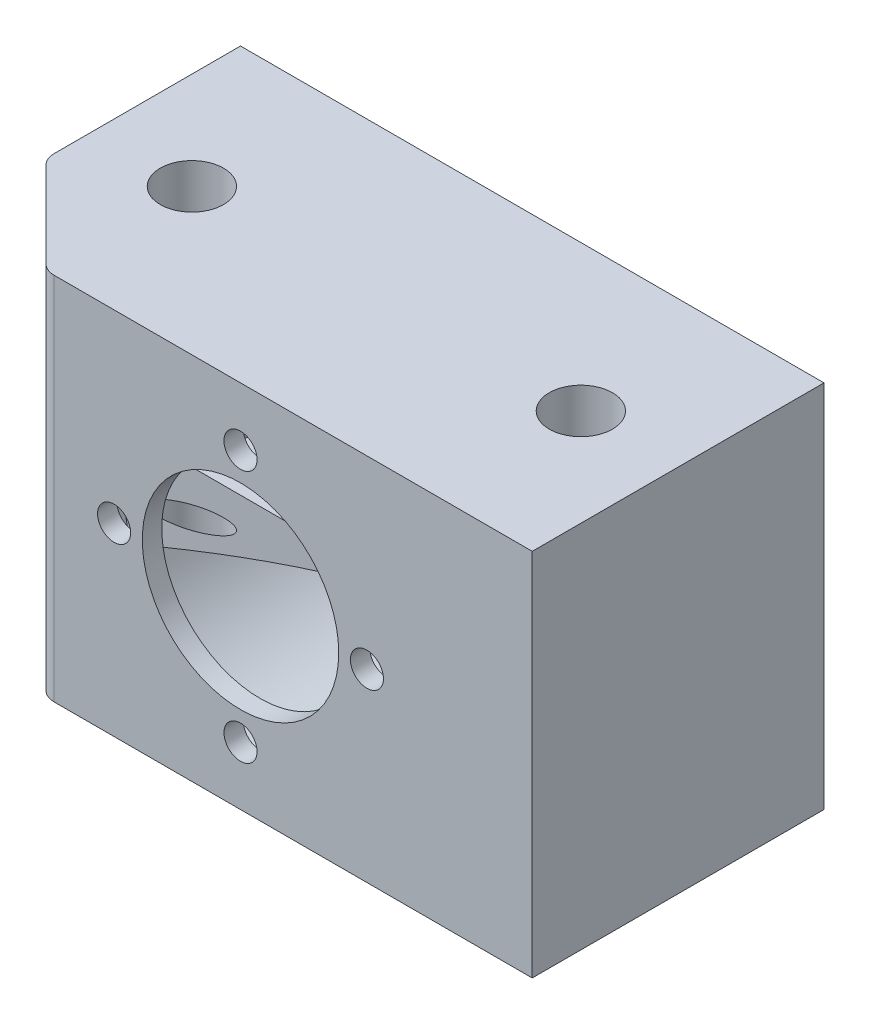
from build123d import *

# Parameters (mm, degrees)
BOSS_EXTRU_1_DEPTH                  = 60
CHANFREIN2_SIZE                     = 10
CHANFREIN2_SIZE2                    = 20
CHANFREIN3_SIZE                     = 20
CHANFREIN3_SIZE2                    = 10
CONG_3_R                            = 2
ENL_V_MAT_EXTRU_4_DEPTH             = 2
ENL_V_MAT_EXTRU_4_DEPTH_BACK        = 66.720872054
ENL_V_MAT_EXTRU_4_START             = -4
ESQUISSE5_R                         = 16.05
ESQUISSE2_R                         = 1.7
ESQUISSE2_R_2                       = 10.1
ENL_V_MAT_EXTRU_1_DEPTH             = 70.720872183
ESQUISSE3_R                         = 1.6
ENL_V_MAT_EXTRU_2_DEPTH             = 78.097341186
ENL_V_MAT_EXTRU_5_REACH             = 71.721
ESQUISSE6_R                         = 3.25
ENL_V_MAT_EXTRU_5_DIRECTION_2_REACH = 71.721
CHANFREIN1_SIZE                     = 10
BOSS_EXTRU_3_REACH                  = 79.097
ESQUISSE8_W                         = 1.2
ESQUISSE8_H                         = 30
CONG_2_R                            = 2


with BuildPart() as part:
    # Esquisse1 → Boss.-Extru.1 (new body)
    with BuildSketch(Plane(origin=(0, 0, 0), x_dir=(0, 0, -1), z_dir=(1, 0, 0))):
        Polygon((0, -19), (0, 19), (30, 19), (30, 15), (4, 15), (4, -15), (30, -15), (30, -19), align=None)
    extrude(amount=BOSS_EXTRU_1_DEPTH)

    # Chanfrein2
    chanfrein2_edges = [part.edges().sort_by_distance(p)[0] for p in [
        (30, 15, -4),
    ]]
    chanfrein2_side = [part.faces().sort_by_distance(p)[0] for p in [
        (30, 0, -4),
    ]]
    chamfer(chanfrein2_edges, length=CHANFREIN2_SIZE, length2=CHANFREIN2_SIZE2, reference=chanfrein2_side[0])

    # Chanfrein3
    chanfrein3_edges = [part.edges().sort_by_distance(p)[0] for p in [
        (30, -15, -4),
    ]]
    chanfrein3_side = [part.faces().sort_by_distance(p)[0] for p in [
        (30, -15, -17),
    ]]
    chamfer(chanfrein3_edges, length=CHANFREIN3_SIZE, length2=CHANFREIN3_SIZE2, reference=chanfrein3_side[0])

    # Congé3
    cong_3_edges = [part.edges().sort_by_distance(p)[0] for p in [
        (30, 5, -4),
        (30, -5, -4),
    ]]
    fillet(cong_3_edges, radius=CONG_3_R)

    # Esquisse5 → Enlèv. mat.-Extru.4 (cut, two sides: drawn at the far end of the back side and taken through both)
    with BuildSketch(Plane.XY.offset(ENL_V_MAT_EXTRU_4_START - ENL_V_MAT_EXTRU_4_DEPTH_BACK)):
        with Locations(Location((30, 0, 0), (0, 0, 193.562911562))):
            Circle(ESQUISSE5_R)
    extrude(amount=ENL_V_MAT_EXTRU_4_DEPTH + ENL_V_MAT_EXTRU_4_DEPTH_BACK, mode=Mode.SUBTRACT)

    # Esquisse2 → Enlèv. mat.-Extru.1 (cut, through all)
    with BuildSketch(Plane.XY):
        with Locations((30, 13)):
            Circle(ESQUISSE2_R)
        with Locations((43, 0)):
            Circle(ESQUISSE2_R)
        with Locations((30, -13)):
            Circle(ESQUISSE2_R)
        with Locations((17, 0)):
            Circle(ESQUISSE2_R)
        with Locations((30, 0)):
            Circle(ESQUISSE2_R_2)
    extrude(amount=-ENL_V_MAT_EXTRU_1_DEPTH, mode=Mode.SUBTRACT)

    # Esquisse3 → Enlèv. mat.-Extru.2 (cut, through all)
    with BuildSketch(Plane.XZ.offset(19)):
        with Locations(Location((10, -15, 0), (0, 0, 270))):
            Circle(ESQUISSE3_R)
        with Locations(Location((50, -15, 0), (0, 0, 270))):
            Circle(ESQUISSE3_R)
    extrude(amount=-ENL_V_MAT_EXTRU_2_DEPTH, mode=Mode.SUBTRACT)

    # Enlèv. mat.-Extru.5: up to this face of the body (flat: up to its plane)
    enl_v_mat_extru_5_end = Plane(part.part.faces().sort_by_distance((30, -19, -15))[0])
    # Esquisse6 → Enlèv. mat.-Extru.5 (cut, up to the picked face)
    with BuildSketch(Plane(origin=(0, 0, 0), x_dir=(1, 0, 0), z_dir=(0, 1, 0)), mode=Mode.PRIVATE) as enl_v_mat_extru_5_sk1:
        with Locations(Location((10, 15, 0), (0, 0, 90))):
            Circle(ESQUISSE6_R)
    enl_v_mat_extru_5_tool1 = split(extrude(enl_v_mat_extru_5_sk1.sketch, amount=-ENL_V_MAT_EXTRU_5_REACH, mode=Mode.PRIVATE), bisect_by=enl_v_mat_extru_5_end, keep=Keep.BOTH, mode=Mode.PRIVATE)
    # Esquisse6 → Enlèv. mat.-Extru.5 (cut, up to the picked face)
    with BuildSketch(Plane(origin=(0, 0, 0), x_dir=(1, 0, 0), z_dir=(0, 1, 0)), mode=Mode.PRIVATE) as enl_v_mat_extru_5_sk2:
        with Locations(Location((50, 15, 0), (0, 0, 270))):
            Circle(ESQUISSE6_R)
    enl_v_mat_extru_5_tool2 = split(extrude(enl_v_mat_extru_5_sk2.sketch, amount=-ENL_V_MAT_EXTRU_5_REACH, mode=Mode.PRIVATE), bisect_by=enl_v_mat_extru_5_end, keep=Keep.BOTH, mode=Mode.PRIVATE)
    add(enl_v_mat_extru_5_tool1.solids().sort_by(Axis((10, 0, -15), (0, -1, 0)))[0], mode=Mode.SUBTRACT)
    add(enl_v_mat_extru_5_tool2.solids().sort_by(Axis((50, 0, -15), (0, -1, 0)))[0], mode=Mode.SUBTRACT)

    # Enlèv. mat.-Extru.5 direction 2: up to this face of the body (flat: up to its plane)
    enl_v_mat_extru_5_direction_2_end = Plane(part.part.faces().sort_by_distance((30, 19, -15))[0])
    # Esquisse6 → Enlèv. mat.-Extru.5 direction 2 (cut, up to the picked face)
    with BuildSketch(Plane(origin=(0, 0, 0), x_dir=(1, 0, 0), z_dir=(0, 1, 0)), mode=Mode.PRIVATE) as enl_v_mat_extru_5_direction_2_sk1:
        with Locations(Location((10, 15, 0), (0, 0, 90))):
            Circle(ESQUISSE6_R)
    enl_v_mat_extru_5_direction_2_tool1 = split(extrude(enl_v_mat_extru_5_direction_2_sk1.sketch, amount=ENL_V_MAT_EXTRU_5_DIRECTION_2_REACH, mode=Mode.PRIVATE), bisect_by=enl_v_mat_extru_5_direction_2_end, keep=Keep.BOTH, mode=Mode.PRIVATE)
    # Esquisse6 → Enlèv. mat.-Extru.5 direction 2 (cut, up to the picked face)
    with BuildSketch(Plane(origin=(0, 0, 0), x_dir=(1, 0, 0), z_dir=(0, 1, 0)), mode=Mode.PRIVATE) as enl_v_mat_extru_5_direction_2_sk2:
        with Locations(Location((50, 15, 0), (0, 0, 270))):
            Circle(ESQUISSE6_R)
    enl_v_mat_extru_5_direction_2_tool2 = split(extrude(enl_v_mat_extru_5_direction_2_sk2.sketch, amount=ENL_V_MAT_EXTRU_5_DIRECTION_2_REACH, mode=Mode.PRIVATE), bisect_by=enl_v_mat_extru_5_direction_2_end, keep=Keep.BOTH, mode=Mode.PRIVATE)
    add(enl_v_mat_extru_5_direction_2_tool1.solids().sort_by(Axis((10, 0, -15), (0, 1, 0)))[0], mode=Mode.SUBTRACT)
    add(enl_v_mat_extru_5_direction_2_tool2.solids().sort_by(Axis((50, 0, -15), (0, 1, 0)))[0], mode=Mode.SUBTRACT)

    # Chanfrein1
    # the kernel refuses this chamfer: 10 mm, written as the material it takes off along each edge
    with BuildSketch(Plane(origin=(0, -44.71682988, 0), x_dir=(-0.027495876610586372, 0, -0.9996219169112968), z_dir=(0, 1, 0))) as chanfrein1_piece_1:
        Polygon((CHANFREIN1_SIZE * 0.999621916911, -CHANFREIN1_SIZE * 0.0274958766106), (-CHANFREIN1_SIZE * 0.0274958766106, -CHANFREIN1_SIZE * 0.999621916911), (0, 0), align=None)
    extrude(amount=89.433659759, mode=Mode.SUBTRACT)

    # Boss.-Extru.3: up to this face of the body (flat: up to its plane)
    boss_extru_3_end = Plane(part.part.faces().sort_by_distance((30.791937825, -19, -15.346472798))[0])
    # Esquisse8 → Boss.-Extru.3 (add, up to the picked face)
    with BuildSketch(Plane(origin=(0, 19, 0), x_dir=(1, 0, 0), z_dir=(0, 1, 0)), mode=Mode.PRIVATE) as boss_extru_3_sk1:
        with Locations((59.4, 15)):
            Rectangle(ESQUISSE8_W, ESQUISSE8_H)
    boss_extru_3_tool1 = split(extrude(boss_extru_3_sk1.sketch, amount=-BOSS_EXTRU_3_REACH, mode=Mode.PRIVATE), bisect_by=boss_extru_3_end, keep=Keep.BOTH, mode=Mode.PRIVATE)
    # Esquisse8 → Boss.-Extru.3 (add, up to the picked face)
    with BuildSketch(Plane(origin=(0, 19, 0), x_dir=(1, 0, 0), z_dir=(0, 1, 0)), mode=Mode.PRIVATE) as boss_extru_3_sk2:
        Polygon((1.2, 30), (1.2, 10.497056275), (10.848528137, 0.848528137), (10, 0), (0, 10), (0, 30), align=None)
    boss_extru_3_tool2 = split(extrude(boss_extru_3_sk2.sketch, amount=-BOSS_EXTRU_3_REACH, mode=Mode.PRIVATE), bisect_by=boss_extru_3_end, keep=Keep.BOTH, mode=Mode.PRIVATE)
    add(boss_extru_3_tool1.solids().sort_by(Axis((59.4, 19, -15), (0, -1, 0)))[0])
    add(boss_extru_3_tool2.solids().sort_by(Axis((0.880987, 19, -20.248528), (0, -1, 0)))[0])

    # Congé2
    cong_2_edges = [part.edges().sort_by_distance(p)[0] for p in [
        (10, 0, 0),
        (0, 0, -10),
    ]]
    fillet(cong_2_edges, radius=CONG_2_R)


solid = part.part
